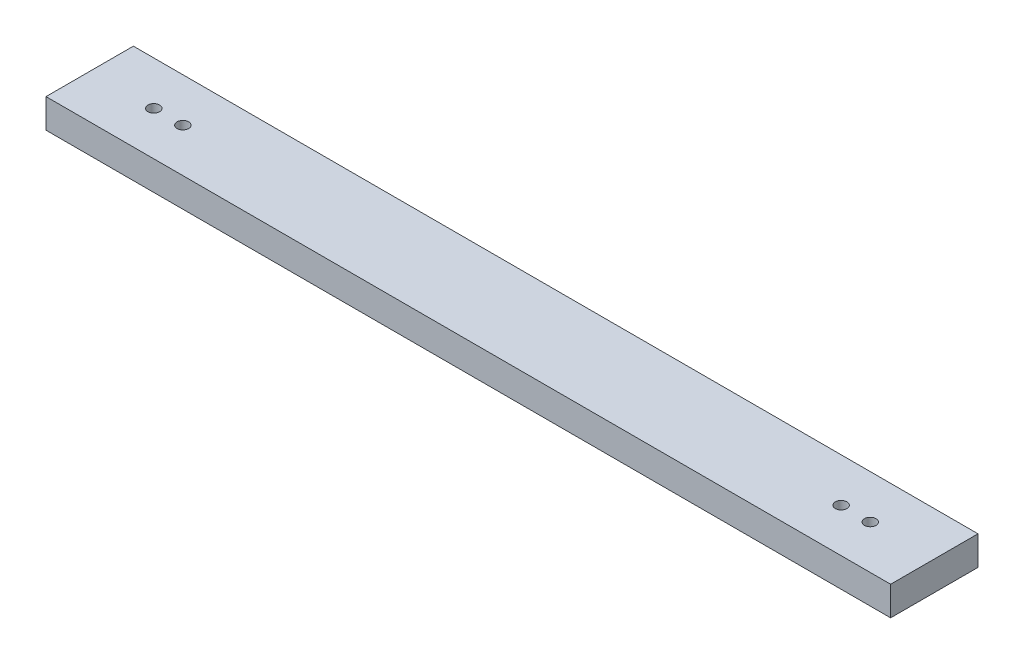
from build123d import *

# Parameters (mm, degrees)
SKETCH3_W           = 580
SKETCH3_H           = 60
BOSS_EXTRUDE1_DEPTH = 20
SKETCH4_R           = 4
CUT_EXTRUDE1_DEPTH  = 586.832740635


with BuildPart() as part:
    # Sketch3 → Boss-Extrude1 (new body)
    with BuildSketch(Plane(origin=(0, 0, 0), x_dir=(1, 0, 0), z_dir=(0, 1, 0))):
        with Locations((290, 50)):
            Rectangle(SKETCH3_W, SKETCH3_H)
    extrude(amount=BOSS_EXTRUDE1_DEPTH)

    # Sketch4 → Cut-Extrude1 (cut, through all)
    with BuildSketch(Plane(origin=(0, 20, 0), x_dir=(1, 0, 0), z_dir=(0, 1, 0))):
        with Locations((44, 50)):
            Circle(SKETCH4_R)
        with Locations((64, 50)):
            Circle(SKETCH4_R)
        with Locations((516, 50)):
            Circle(SKETCH4_R)
        with Locations((536, 50)):
            Circle(SKETCH4_R)
    extrude(amount=-CUT_EXTRUDE1_DEPTH, mode=Mode.SUBTRACT)


solid = part.part
